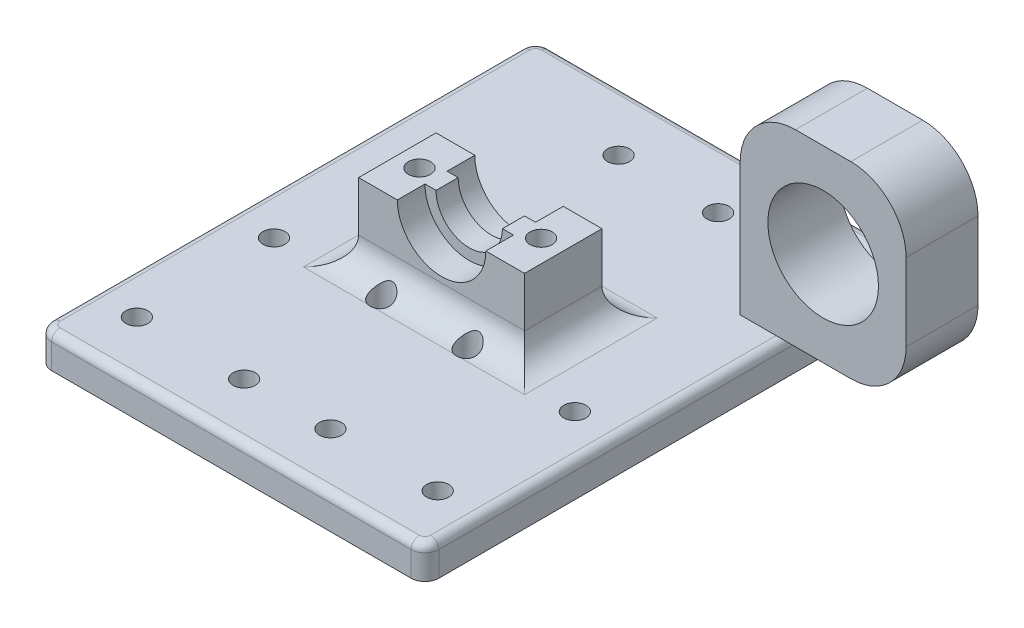
from build123d import *

# Parameters (mm, degrees)
SKETCH1_W           = 70
SKETCH1_H           = 90
SKETCH1_R           = 2
BOSS_EXTRUDE1_DEPTH = 6
SKETCH3_W           = 15
SKETCH3_H           = 7
BOSS_EXTRUDE2_DEPTH = 14
FILLET1_R           = 2.5
FILLET2_R           = 1.5
CUT_EXTRUDE1_DEPTH  = 22
SKETCH5_R           = 6
CUT_EXTRUDE2_DEPTH  = 22
CUT_EXTRUDE4_DEPTH  = 5
CUT_EXTRUDE5_START  = -5
SKETCH9_R           = 8
SKETCH9_R_2         = 6
CUT_EXTRUDE5_DEPTH  = 5
FILLET3_R           = 5
SKETCH10_W          = 30
SKETCH10_H          = 13
BOSS_EXTRUDE5_DEPTH = 34
CUT_EXTRUDE6_DEPTH  = 34
FILLET5_R           = 10


with BuildPart() as part:
    # Sketch1 → Boss-Extrude1 (new body)
    with BuildSketch(Plane(origin=(0, 0, 0), x_dir=(1, 0, 0), z_dir=(0, 1, 0))):
        with Locations((26.984435798, -1.40077821)):
            Rectangle(SKETCH1_W, SKETCH1_H)
        with Locations(Location((17.984435798, 32.59922179, 0), (0, 0, 270))):
            Circle(SKETCH1_R, mode=Mode.SUBTRACT)
        with Locations(Location((18.095011811, 8.59922179, 0), (0, 0, 270))):
            Circle(SKETCH1_R, mode=Mode.SUBTRACT)
        with Locations(Location((35.873859784, 8.59922179, 0), (0, 0, 270))):
            Circle(SKETCH1_R, mode=Mode.SUBTRACT)
        with Locations(Location((35.984435798, 32.59922179, 0), (0, 0, 270))):
            Circle(SKETCH1_R, mode=Mode.SUBTRACT)
        with Locations(Location((19.184435798, -11.50077821, 0), (0, 0, 270))):
            Circle(SKETCH1_R, mode=Mode.SUBTRACT)
        with Locations(Location((-0.215564202, -11.50077821, 0), (0, 0, 270))):
            Circle(SKETCH1_R, mode=Mode.SUBTRACT)
        with Locations(Location((-0.215564202, -36.30077821, 0), (0, 0, 270))):
            Circle(SKETCH1_R, mode=Mode.SUBTRACT)
        with Locations(Location((19.184435798, -36.30077821, 0), (0, 0, 270))):
            Circle(SKETCH1_R, mode=Mode.SUBTRACT)
        with Locations(Location((54.184435798, -36.30077821, 0), (0, 0, 270))):
            Circle(SKETCH1_R, mode=Mode.SUBTRACT)
        with Locations(Location((34.784435798, -36.30077821, 0), (0, 0, 90))):
            Circle(SKETCH1_R, mode=Mode.SUBTRACT)
        with Locations(Location((34.784435798, -11.50077821, 0), (0, 0, 270))):
            Circle(SKETCH1_R, mode=Mode.SUBTRACT)
        with Locations(Location((54.184435798, -11.50077821, 0), (0, 0, 270))):
            Circle(SKETCH1_R, mode=Mode.SUBTRACT)
    extrude(amount=BOSS_EXTRUDE1_DEPTH)

    # Sketch3 → Boss-Extrude2 (add)
    with BuildSketch(Plane(origin=(0, 6, 0), x_dir=(1, 0, 0), z_dir=(0, 1, 0))):
        with Locations((19.484435798, 2.09922179)):
            Rectangle(SKETCH3_W, SKETCH3_H)
        with Locations((34.484435798, 2.09922179)):
            Rectangle(SKETCH3_W, SKETCH3_H)
        with Locations((34.484435798, -4.90077821)):
            Rectangle(SKETCH3_W, SKETCH3_H)
        with Locations((19.484435798, -4.90077821)):
            Rectangle(SKETCH3_W, SKETCH3_H)
    extrude(amount=BOSS_EXTRUDE2_DEPTH)

    # Fillet1
    fillet1_edges = [part.edges().sort_by_distance(p)[0] for p in [
        (-8.015564202, 3, 46.40077821),
        (-8.015564202, 3, -43.59922179),
        (61.984435798, 3, -43.59922179),
        (61.984435798, 3, 46.40077821),
    ]]
    fillet(fillet1_edges, radius=FILLET1_R)

    # Fillet2
    fillet2_edges = [part.edges().sort_by_distance(p)[0] for p in [
        (-8.015564202, 6, 1.40077821),
        (26.984435798, 6, -43.59922179),
        (26.984435798, 6, 46.40077821),
        (61.984435798, 6, 1.40077821),
        (-7.283331155, 6, 45.668545163),
        (61.252202751, 6, 45.668545163),
        (61.252202751, 6, -42.866988743),
        (-7.283331155, 6, -42.866988743),
    ]]
    fillet(fillet2_edges, radius=FILLET2_R)

    # Sketch4 → Cut-Extrude1 (cut)
    with BuildSketch(Plane(origin=(0, 20, 0), x_dir=(1, 0, 0), z_dir=(0, 1, 0))):
        with BuildLine():
            ThreePointArc((17.984435798, -1.40077821), (15.984435798, 0.59922179), (13.984435798, -1.40077821))
            Line((13.984435798, -1.40077821), (17.984435798, -1.40077821))
        make_face()
        with BuildLine():
            Line((17.984435798, -1.40077821), (13.984435798, -1.40077821))
            ThreePointArc((13.984435798, -1.40077821), (15.984435798, -3.40077821), (17.984435798, -1.40077821))
        make_face()
        with BuildLine():
            ThreePointArc((39.984435798, -1.40077821), (37.984435798, 0.59922179), (35.984435798, -1.40077821))
            Line((35.984435798, -1.40077821), (39.984435798, -1.40077821))
        make_face()
        with BuildLine():
            Line((39.984435798, -1.40077821), (35.984435798, -1.40077821))
            ThreePointArc((35.984435798, -1.40077821), (37.984435798, -3.40077821), (39.984435798, -1.40077821))
        make_face()
    extrude(amount=-CUT_EXTRUDE1_DEPTH, mode=Mode.SUBTRACT)

    # Sketch5 → Cut-Extrude2 (cut)
    with BuildSketch(Plane(origin=(0, 0, -5.59922179), x_dir=(-1, 0, 0), z_dir=(0, 0, -1))):
        with Locations((-26.984435798, 20)):
            Circle(SKETCH5_R)
    extrude(amount=-CUT_EXTRUDE2_DEPTH, mode=Mode.SUBTRACT)

    # Sketch6 → Cut-Extrude4 (cut)
    with BuildSketch(Plane(origin=(0, 0, -5.59922179), x_dir=(-1, 0, 0), z_dir=(0, 0, -1))):
        with BuildLine():
            ThreePointArc((-34.984435798, 20), (-26.984435798, 12), (-18.984435798, 20))
            Line((-18.984435798, 20), (-20.984435798, 20))
            ThreePointArc((-20.984435798, 20), (-26.984435798, 14), (-32.984435798, 20))
            Line((-32.984435798, 20), (-34.984435798, 20))
        make_face()
    extrude(amount=-CUT_EXTRUDE4_DEPTH, mode=Mode.SUBTRACT)

    # Sketch9 → Cut-Extrude5 (cut)
    with BuildSketch(Plane.XY.offset(8.40077821).offset(CUT_EXTRUDE5_START)):
        with Locations((26.984435798, 20)):
            Circle(SKETCH9_R)
        with Locations((26.984435798, 20)):
            Circle(SKETCH9_R_2, mode=Mode.SUBTRACT)
    extrude(amount=CUT_EXTRUDE5_DEPTH, mode=Mode.SUBTRACT)

    # Fillet3
    # the kernel refuses this fillet: 5 mm, written as the material it adds along each edge
    with BuildSketch(Plane(origin=(41.984435798, 6, 8.40077821), x_dir=(0, 0, 1), z_dir=(-1, 0, 0))) as fillet3_piece_1_section:
        with BuildLine():
            CenterArc((FILLET3_R, FILLET3_R), FILLET3_R, 180, 90)
            Line((0, FILLET3_R), (0, 0))
            Line((0, 0), (FILLET3_R, 0))
        make_face()
    fillet3_piece_1 = extrude(amount=30, mode=Mode.PRIVATE)
    fillet3_piece_1 = fillet3_piece_1 - Plane(origin=(34.784435798, 7.197458463, 11.50077821), x_dir=(0, 0, 1), z_dir=(0, -1, 0)) * Cylinder(2, 80, mode=Mode.PRIVATE)
    fillet3_piece_1 = fillet3_piece_1 - Plane(origin=(19.184435798, 7.197458463, 11.50077821), x_dir=(0, 0, 1), z_dir=(0, -1, 0)) * Cylinder(2, 80, mode=Mode.PRIVATE)
    add(fillet3_piece_1)
    with BuildSketch(Plane(origin=(11.984435798, 6, -5.59922179), x_dir=(-1, 0, 0), z_dir=(0, 0, 1))) as fillet3_piece_2:
        with BuildLine():
            CenterArc((FILLET3_R, -FILLET3_R), FILLET3_R, 90, 90)
            Line((0, -FILLET3_R), (0, 0))
            Line((0, 0), (FILLET3_R, 0))
        make_face()
    extrude(amount=14)
    with BuildSketch(Plane(origin=(41.984435798, 6, -5.59922179), x_dir=(0, 0, -1), z_dir=(-1, 0, 0))) as fillet3_piece_3_section:
        with BuildLine():
            CenterArc((FILLET3_R, -FILLET3_R), FILLET3_R, 90, 90)
            Line((0, -FILLET3_R), (0, 0))
            Line((0, 0), (FILLET3_R, 0))
        make_face()
    fillet3_piece_3 = extrude(amount=30, mode=Mode.PRIVATE)
    fillet3_piece_3 = fillet3_piece_3 - Plane(origin=(35.873859784, 7.200103182, -8.59922179), x_dir=(0, 0, 1), z_dir=(0, -1, 0)) * Cylinder(2, 80, mode=Mode.PRIVATE)
    fillet3_piece_3 = fillet3_piece_3 - Plane(origin=(18.095011811, 7.200103182, -8.59922179), x_dir=(0, 0, 1), z_dir=(0, -1, 0)) * Cylinder(2, 80, mode=Mode.PRIVATE)
    add(fillet3_piece_3)
    with BuildSketch(Plane(origin=(41.984435798, 6, -5.59922179), x_dir=(1, 0, 0), z_dir=(0, 0, 1))) as fillet3_piece_4:
        with BuildLine():
            CenterArc((FILLET3_R, FILLET3_R), FILLET3_R, 180, 90)
            Line((0, FILLET3_R), (0, 0))
            Line((0, 0), (FILLET3_R, 0))
        make_face()
    extrude(amount=14)
    with BuildSketch(Plane(origin=(41.984435798, 6, -5.59922179), x_dir=(1, 0, 0), z_dir=(0, 0, 1))) as fillet3_piece_5a_section:
        with BuildLine():
            CenterArc((FILLET3_R, FILLET3_R), FILLET3_R, 180, 90)
            Line((0, FILLET3_R), (0, 0))
            Line((0, 0), (FILLET3_R, 0))
        make_face()
    fillet3_piece_5a = extrude(amount=26.5, mode=Mode.PRIVATE)
    fillet3_piece_5a = split(fillet3_piece_5a, bisect_by=Plane(origin=(43.116411369, 7.131975571, 8.40077821), z_dir=(0, 0, 1)), keep=Keep.TOP, mode=Mode.PRIVATE)
    with BuildSketch(Plane(origin=(54.484435798, 6, 8.40077821), x_dir=(0, 0, 1), z_dir=(-1, 0, 0))) as fillet3_piece_5b_section:
        with BuildLine():
            CenterArc((FILLET3_R, FILLET3_R), FILLET3_R, 180, 90)
            Line((0, FILLET3_R), (0, 0))
            Line((0, 0), (FILLET3_R, 0))
        make_face()
    fillet3_piece_5b = extrude(amount=42.5, mode=Mode.PRIVATE)
    fillet3_piece_5b = fillet3_piece_5b - Plane(origin=(54.184435798, 7.177432689, 11.50077821), x_dir=(0, 0, 1), z_dir=(0, -1, 0)) * Cylinder(2, 105, mode=Mode.PRIVATE)
    fillet3_piece_5b = split(fillet3_piece_5b, bisect_by=Plane(origin=(41.984435798, 7.177432689, 9.458456652), z_dir=(1, 0, 0)), keep=Keep.TOP, mode=Mode.PRIVATE)
    fillet3_piece_5 = fillet3_piece_5a & fillet3_piece_5b
    add(fillet3_piece_5)
    with BuildSketch(Plane(origin=(41.984435798, 6, 8.40077821), x_dir=(0, 0, 1), z_dir=(-1, 0, 0))) as fillet3_piece_6a_section:
        with BuildLine():
            CenterArc((FILLET3_R, FILLET3_R), FILLET3_R, 180, 90)
            Line((0, FILLET3_R), (0, 0))
            Line((0, 0), (FILLET3_R, 0))
        make_face()
    fillet3_piece_6a = extrude(amount=42.5, mode=Mode.PRIVATE)
    fillet3_piece_6a = fillet3_piece_6a - Plane(origin=(-0.215564202, 7.17743263, 11.50077821), x_dir=(0, 0, 1), z_dir=(0, -1, 0)) * Cylinder(2, 105, mode=Mode.PRIVATE)
    fillet3_piece_6a = split(fillet3_piece_6a, bisect_by=Plane(origin=(11.984435798, 7.17743263, 9.458456401), z_dir=(-1, 0, 0)), keep=Keep.TOP, mode=Mode.PRIVATE)
    with BuildSketch(Plane(origin=(11.984435798, 6, -5.59922179), x_dir=(-1, 0, 0), z_dir=(0, 0, 1))) as fillet3_piece_6b_section:
        with BuildLine():
            CenterArc((FILLET3_R, -FILLET3_R), FILLET3_R, 90, 90)
            Line((0, -FILLET3_R), (0, 0))
            Line((0, 0), (FILLET3_R, 0))
        make_face()
    fillet3_piece_6b = extrude(amount=26.5, mode=Mode.PRIVATE)
    fillet3_piece_6b = split(fillet3_piece_6b, bisect_by=Plane(origin=(10.852460226, 7.131975571, 8.40077821), z_dir=(0, 0, 1)), keep=Keep.TOP, mode=Mode.PRIVATE)
    fillet3_piece_6 = fillet3_piece_6a & fillet3_piece_6b
    add(fillet3_piece_6)
    with BuildSketch(Plane(origin=(11.984435798, 6, -18.09922179), x_dir=(-1, 0, 0), z_dir=(0, 0, 1))) as fillet3_piece_7a_section:
        with BuildLine():
            CenterArc((FILLET3_R, -FILLET3_R), FILLET3_R, 90, 90)
            Line((0, -FILLET3_R), (0, 0))
            Line((0, 0), (FILLET3_R, 0))
        make_face()
    fillet3_piece_7a = extrude(amount=26.5, mode=Mode.PRIVATE)
    fillet3_piece_7a = split(fillet3_piece_7a, bisect_by=Plane(origin=(10.852460226, 7.131975571, -5.59922179), z_dir=(0, 0, -1)), keep=Keep.TOP, mode=Mode.PRIVATE)
    with BuildSketch(Plane(origin=(41.984435798, 6, -5.59922179), x_dir=(0, 0, -1), z_dir=(-1, 0, 0))) as fillet3_piece_7b_section:
        with BuildLine():
            CenterArc((FILLET3_R, -FILLET3_R), FILLET3_R, 90, 90)
            Line((0, -FILLET3_R), (0, 0))
            Line((0, 0), (FILLET3_R, 0))
        make_face()
    fillet3_piece_7b = extrude(amount=42.5, mode=Mode.PRIVATE)
    fillet3_piece_7b = split(fillet3_piece_7b, bisect_by=Plane(origin=(11.984435798, 7.131975571, -6.731197361), z_dir=(-1, 0, 0)), keep=Keep.TOP, mode=Mode.PRIVATE)
    fillet3_piece_7 = fillet3_piece_7a & fillet3_piece_7b
    add(fillet3_piece_7)
    with BuildSketch(Plane(origin=(41.984435798, 6, -18.09922179), x_dir=(1, 0, 0), z_dir=(0, 0, 1))) as fillet3_piece_8a_section:
        with BuildLine():
            CenterArc((FILLET3_R, FILLET3_R), FILLET3_R, 180, 90)
            Line((0, FILLET3_R), (0, 0))
            Line((0, 0), (FILLET3_R, 0))
        make_face()
    fillet3_piece_8a = extrude(amount=26.5, mode=Mode.PRIVATE)
    fillet3_piece_8a = split(fillet3_piece_8a, bisect_by=Plane(origin=(43.116411369, 7.131975571, -5.59922179), z_dir=(0, 0, -1)), keep=Keep.TOP, mode=Mode.PRIVATE)
    with BuildSketch(Plane(origin=(54.484435798, 6, -5.59922179), x_dir=(0, 0, -1), z_dir=(-1, 0, 0))) as fillet3_piece_8b_section:
        with BuildLine():
            CenterArc((FILLET3_R, -FILLET3_R), FILLET3_R, 90, 90)
            Line((0, -FILLET3_R), (0, 0))
            Line((0, 0), (FILLET3_R, 0))
        make_face()
    fillet3_piece_8b = extrude(amount=42.5, mode=Mode.PRIVATE)
    fillet3_piece_8b = split(fillet3_piece_8b, bisect_by=Plane(origin=(41.984435798, 7.131975571, -6.731197361), z_dir=(1, 0, 0)), keep=Keep.TOP, mode=Mode.PRIVATE)
    fillet3_piece_8 = fillet3_piece_8a & fillet3_piece_8b
    add(fillet3_piece_8)

    # Sketch10 → Boss-Extrude5 (add)
    with BuildSketch(Plane(origin=(0, 6, 0), x_dir=(1, 0, 0), z_dir=(0, 1, 0))):
        with Locations((68.984435798, 25.09922179)):
            Rectangle(SKETCH10_W, SKETCH10_H)
    extrude(amount=BOSS_EXTRUDE5_DEPTH)

    # Sketch13 → Cut-Extrude6 (cut)
    with BuildSketch(Plane.XY.offset(-18.59922179)):
        with BuildLine():
            ThreePointArc((78.984435798, 23), (76.05550361, 30.071067812), (68.984435798, 33))
            Line((68.984435798, 33), (68.984435798, 23))
            Line((68.984435798, 23), (78.984435798, 23))
        make_face()
        with BuildLine():
            Line((68.984435798, 23), (68.984435798, 33))
            ThreePointArc((68.984435798, 33), (61.913367986, 30.071067812), (58.984435798, 23))
            Line((58.984435798, 23), (68.984435798, 23))
        make_face()
        with BuildLine():
            Line((78.984435798, 23), (68.984435798, 23))
            Line((68.984435798, 23), (68.984435798, 13))
            ThreePointArc((68.984435798, 13), (76.05550361, 15.928932188), (78.984435798, 23))
        make_face()
        with BuildLine():
            Line((68.984435798, 13), (68.984435798, 23))
            Line((68.984435798, 23), (58.984435798, 23))
            ThreePointArc((58.984435798, 23), (61.913367986, 15.928932188), (68.984435798, 13))
        make_face()
    extrude(amount=-CUT_EXTRUDE6_DEPTH, mode=Mode.SUBTRACT)

    # Fillet5
    fillet5_edges = [part.edges().sort_by_distance(p)[0] for p in [
        (83.984435798, 6, -25.09922179),
        (83.984435798, 40, -25.09922179),
        (53.984435798, 40, -25.09922179),
    ]]
    fillet(fillet5_edges, radius=FILLET5_R)


solid = part.part
